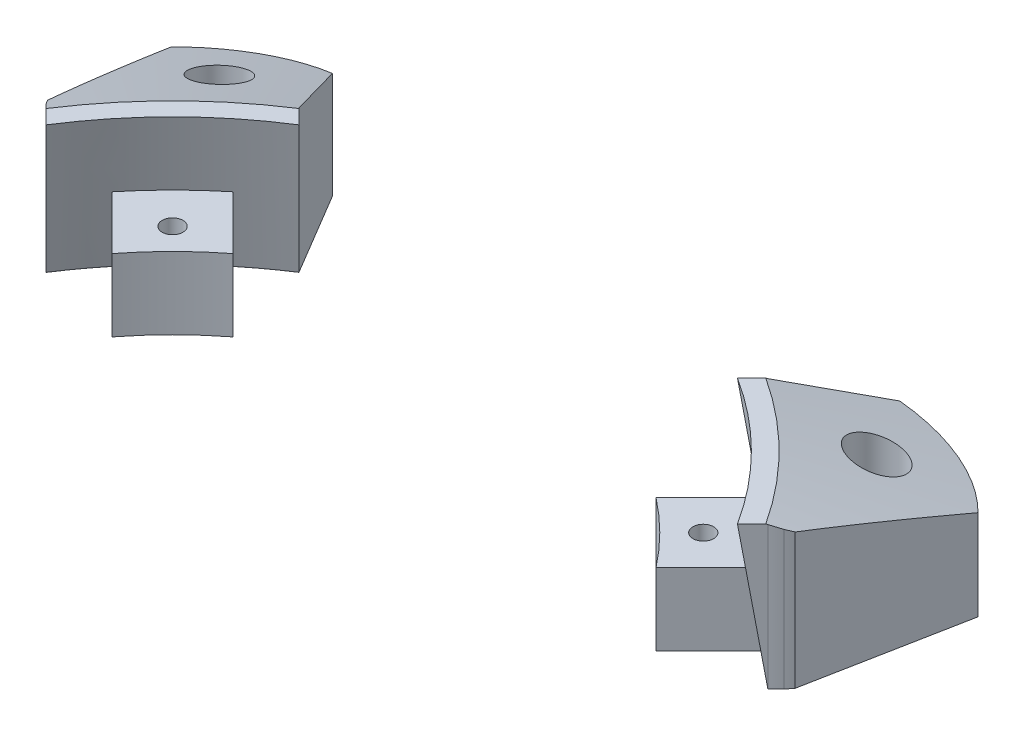
from build123d import *

# Parameters (mm, degrees)
SALIENTE_EXTRUIR1_START = -36.400588291
SALIENTE_EXTRUIR1_DEPTH = 10.1
SALIENTE_EXTRUIR2_REACH = 99.517
SALIENTE_EXTRUIR2_START = -2.5
CROQUIS2_W              = 25
CROQUIS2_H              = 20
SALIENTE_EXTRUIR3_REACH = 101.384
CORTAR_EXTRUIR1_START   = -6
CROQUIS5_R              = 3.5
CORTAR_EXTRUIR1_DEPTH   = 19
CROQUIS7_R              = 1.45
CORTAR_EXTRUIR2_DEPTH   = 10
CROQUIS8_R              = 1.45
CORTAR_EXTRUIR3_DEPTH   = 12
CROQUIS9_R              = 3
CORTAR_EXTRUIR4_DEPTH   = 3


# Read off the part's stored shape, not the designer's step: Saliente-Extruir1
with BuildPart() as part:
    # Saliente-Extruir1 outline → Saliente-Extruir1 (new body)
    with BuildSketch(Plane(origin=(0, 0, 0), x_dir=(1, 0, 0), z_dir=(0, 1, 0)).offset(SALIENTE_EXTRUIR1_START)):
        with BuildLine():
            Line((22.502132111, -90.425189571), (33.23240821, -79.694913472))
            Line((33.23240821, -79.694913472), (24.747126835, -71.209632098))
            Line((24.747126835, -71.209632098), (14.016850737, -81.939908197))
            ThreePointArc((14.016850737, -81.939908197), (18.524587161, -85.917453147), (22.502132111, -90.425189571))
        make_face()
    extrude(amount=SALIENTE_EXTRUIR1_DEPTH)

    # Saliente-Extruir2: up to this cone (the profile starts outside it)
    saliente_extruir2_end = Plane(origin=(-15.557959692, -26.400588, 120), z_dir=(0, -1, 0)) * Cone(35.386185904, 82.076939664, 317.497125568, mode=Mode.PRIVATE)
    # Croquis2 → Saliente-Extruir2 (add, up to the surface)
    with BuildSketch(Plane(origin=(-23.231252631, 0, 23.231252631), x_dir=(-0.7071067811865487, 0, -0.7071067811865464), z_dir=(0.7071067811865464, 0, -0.7071067811865487)).offset(SALIENTE_EXTRUIR2_START), mode=Mode.PRIVATE) as saliente_extruir2_sk1:
        with Locations((-73.851674943, -26.400588291)):
            Rectangle(CROQUIS2_W, CROQUIS2_H)
    saliente_extruir2_tool1 = extrude(saliente_extruir2_sk1.sketch, amount=-SALIENTE_EXTRUIR2_REACH, mode=Mode.PRIVATE) - saliente_extruir2_end
    add(saliente_extruir2_tool1.solids().sort_by_distance((27.222001, -26.400588, 77.22004))[0])

    # Saliente-Extruir3: up to this face of the body (flat: up to its plane)
    saliente_extruir3_end = Plane(part.part.faces().sort_by_distance((25.898715454, -16.400588291, 78.543324853))[0])
    # Croquis3 → Saliente-Extruir3 (add, up to the picked face)
    with BuildSketch(Plane.XZ.offset(36.400588291), mode=Mode.PRIVATE) as saliente_extruir3_sk1:
        with BuildLine():
            Line((24.125229727, 57.959611077), (17.243270384, 69.521100394))
            ThreePointArc((17.243270384, 69.521100394), (27.009868535, 77.432171773), (34.920939914, 87.198769923))
            ThreePointArc((34.920939914, 87.198769923), (35.889801945, 86.247084042), (36.74992881, 85.196093352))
            Line((36.74992881, 85.196093352), (40.879917291, 63.755689906))
            ThreePointArc((40.879917291, 63.755689906), (33.179893077, 58.8997272), (24.125229727, 57.959611077))
        make_face()
    saliente_extruir3_tool1 = split(extrude(saliente_extruir3_sk1.sketch, amount=-SALIENTE_EXTRUIR3_REACH, mode=Mode.PRIVATE), bisect_by=saliente_extruir3_end, keep=Keep.BOTH, mode=Mode.PRIVATE)
    add(saliente_extruir3_tool1.solids().sort_by(Axis((30.570444, -36.400588, 69.72951), (0, 1, 0)))[0])

    # Croquis4 → Cortar-Revolución1 (revolve, cut)
    with BuildSketch(Plane(origin=(-15.557959692, -2.400588291, 120), x_dir=(0, 0, -1), z_dir=(1, 0, 0))):
        Polygon((60, -14), (100, -29), (100, -12.364078099), (60, -12.364078099), align=None)
    revolve(axis=Axis((-15.557959692, -2.400588291, 120), (0, -1, 0)), mode=Mode.SUBTRACT)

    # Croquis5 → Cortar-Extruir1 (cut)
    with BuildSketch(Plane.XZ.offset(36.400588291).offset(CORTAR_EXTRUIR1_START)):
        with Locations(Location((30.420802392, 67.470387392, 0), (0, 0, 270))):
            Circle(CROQUIS5_R)
    extrude(amount=-CORTAR_EXTRUIR1_DEPTH, mode=Mode.SUBTRACT)

    # Croquis7 → Cortar-Extruir2 (cut)
    with BuildSketch(Plane.XZ.offset(36.400588291)):
        with Locations(Location((30.420802392, 67.470387392, 0), (0, 0, 270))):
            Circle(CROQUIS7_R)
    extrude(amount=-CORTAR_EXTRUIR2_DEPTH, mode=Mode.SUBTRACT)

    # Croquis8 → Cortar-Extruir3 (cut)
    with BuildSketch(Plane(origin=(0, -26.300588291, 0), x_dir=(1, 0, 0), z_dir=(0, 1, 0))):
        with Locations(Location((21.56514632, -82.876893988, 0), (0, 0, 270))):
            Circle(CROQUIS8_R)
    extrude(amount=-CORTAR_EXTRUIR3_DEPTH, mode=Mode.SUBTRACT)

    # Croquis9 → Cortar-Extruir4 (cut)
    with BuildSketch(Plane.XZ.offset(36.400588291)):
        with Locations(Location((21.56514632, 82.876893988, 0), (0, 0, 270))):
            Circle(CROQUIS9_R)
    extrude(amount=-CORTAR_EXTRUIR4_DEPTH, mode=Mode.SUBTRACT)


with BuildPart() as body_2:
    # Simetría5: mirrored copy
    add(part.part.mirror(Plane(origin=(-15.557959692, -2.400588291, 120), x_dir=(0, 0, 1), z_dir=(1, 0, 0))))


solid = Compound([part.part, body_2.part])
